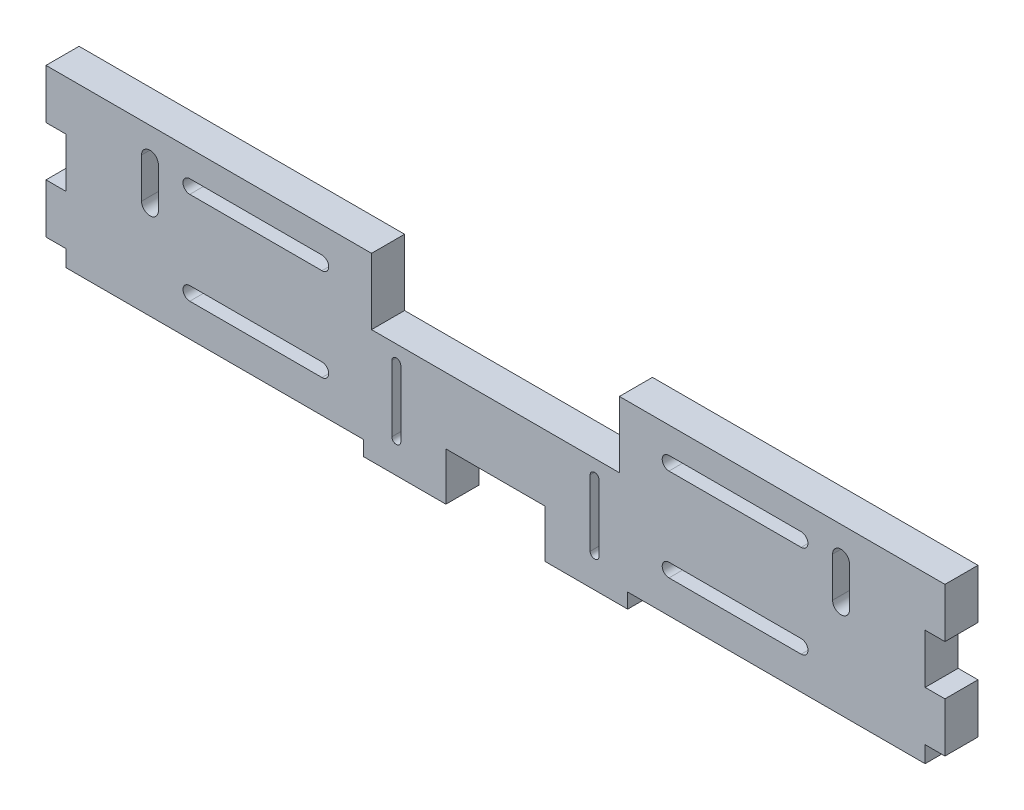
from build123d import *

# Parameters (mm, degrees)
EXTRUDE_1_DEPTH     = 10
CUT_EXTRUDE_1_DEPTH = 140.112364655
SKETCH_3_W          = 30
SKETCH_3_H          = 10
SKETCH_3_W_2        = 75
SKETCH_3_H_2        = 20
CUT_EXTRUDE_2_DEPTH = 140.112364655
SKETCH_4_W          = 25
SKETCH_4_H          = 10
EXTRUDE_2_DEPTH     = 4.5
CUT_EXTRUDE_3_DEPTH = 141.071410359


with BuildPart() as part:
    # 草圖1 → 填料-伸長1 (new body)
    with BuildSketch(Plane.XY):
        Polygon((136, -22.5), (136, -7.5), (130, -7.5), (130, 7.5), (136, 7.5), (136, 22.5), (-136, 22.5), (-136, 7.5), (-130, 7.5), (-130, -7.5), (-136, -7.5), (-136, -22.5), (-130, -22.5), (-130, -27.5), (130, -27.5), (130, -22.5), align=None)
        with BuildLine():
            Line((-31.35, -22.5), (-31.35, -2.5))
            ThreePointArc((-31.35, -2.5), (-30, -1.15), (-28.65, -2.5))
            Line((-28.65, -2.5), (-28.65, -22.5))
            ThreePointArc((-28.65, -22.5), (-30, -23.85), (-31.35, -22.5))
        make_face(mode=Mode.SUBTRACT)
        with BuildLine():
            Line((31.35, -22.5), (31.35, -2.5))
            ThreePointArc((31.35, -2.5), (30, -1.15), (28.65, -2.5))
            Line((28.65, -2.5), (28.65, -22.5))
            ThreePointArc((28.65, -22.5), (30, -23.85), (31.35, -22.5))
        make_face(mode=Mode.SUBTRACT)
    extrude(amount=EXTRUDE_1_DEPTH)

    # 草圖2 → 除料-伸長1 (cut, through all)
    with BuildSketch(Plane.XY.offset(10)):
        with BuildLine():
            Line((-92.5, 14.55), (-52.5, 14.55))
            ThreePointArc((-52.5, 14.55), (-50.45, 12.5), (-52.5, 10.45))
            Line((-52.5, 10.45), (-92.5, 10.45))
            ThreePointArc((-92.5, 10.45), (-94.55, 12.5), (-92.5, 14.55))
        make_face()
        with BuildLine():
            Line((-92.5, -13.45), (-52.5, -13.45))
            ThreePointArc((-52.5, -13.45), (-50.45, -15.5), (-52.5, -17.55))
            Line((-52.5, -17.55), (-92.5, -17.55))
            ThreePointArc((-92.5, -17.55), (-94.55, -15.5), (-92.5, -13.45))
        make_face()
        with BuildLine():
            Line((92.5, 14.55), (52.5, 14.55))
            ThreePointArc((52.5, 14.55), (50.45, 12.5), (52.5, 10.45))
            Line((52.5, 10.45), (92.5, 10.45))
            ThreePointArc((92.5, 10.45), (94.55, 12.5), (92.5, 14.55))
        make_face()
        with BuildLine():
            Line((92.5, -13.45), (52.5, -13.45))
            ThreePointArc((52.5, -13.45), (50.45, -15.5), (52.5, -17.55))
            Line((52.5, -17.55), (92.5, -17.55))
            ThreePointArc((92.5, -17.55), (94.55, -15.5), (92.5, -13.45))
        make_face()
    extrude(amount=-CUT_EXTRUDE_1_DEPTH, mode=Mode.SUBTRACT)

    # 草圖3 → 除料-伸長2 (cut, through all)
    with BuildSketch(Plane.XY.offset(10)):
        with Locations((0, -22.5)):
            Rectangle(SKETCH_3_W, SKETCH_3_H)
        with Locations((0, 12.5)):
            Rectangle(SKETCH_3_W_2, SKETCH_3_H_2)
    extrude(amount=-CUT_EXTRUDE_2_DEPTH, mode=Mode.SUBTRACT)

    # 草圖4 → 填料-伸長2 (add)
    with BuildSketch(Plane.XZ.offset(27.5)):
        with Locations((-27.5, 5)):
            Rectangle(SKETCH_4_W, SKETCH_4_H)
        with Locations((27.5, 5)):
            Rectangle(SKETCH_4_W, SKETCH_4_H)
    extrude(amount=EXTRUDE_2_DEPTH)

    # 草圖5 → 除料-伸長3 (cut, through all)
    with BuildSketch(Plane.XY.offset(10)):
        with BuildLine():
            Line((-107.1, 13.45), (-107.1, 1.35))
            ThreePointArc((-107.1, 1.35), (-104.55, -1.2), (-102, 1.35))
            Line((-102, 1.35), (-102, 13.45))
            ThreePointArc((-102, 13.45), (-104.55, 16), (-107.1, 13.45))
        make_face()
        with BuildLine():
            Line((107.1, 13.45), (107.1, 1.35))
            ThreePointArc((107.1, 1.35), (104.55, -1.2), (102, 1.35))
            Line((102, 1.35), (102, 13.45))
            ThreePointArc((102, 13.45), (104.55, 16), (107.1, 13.45))
        make_face()
    extrude(amount=-CUT_EXTRUDE_3_DEPTH, mode=Mode.SUBTRACT)


solid = part.part
